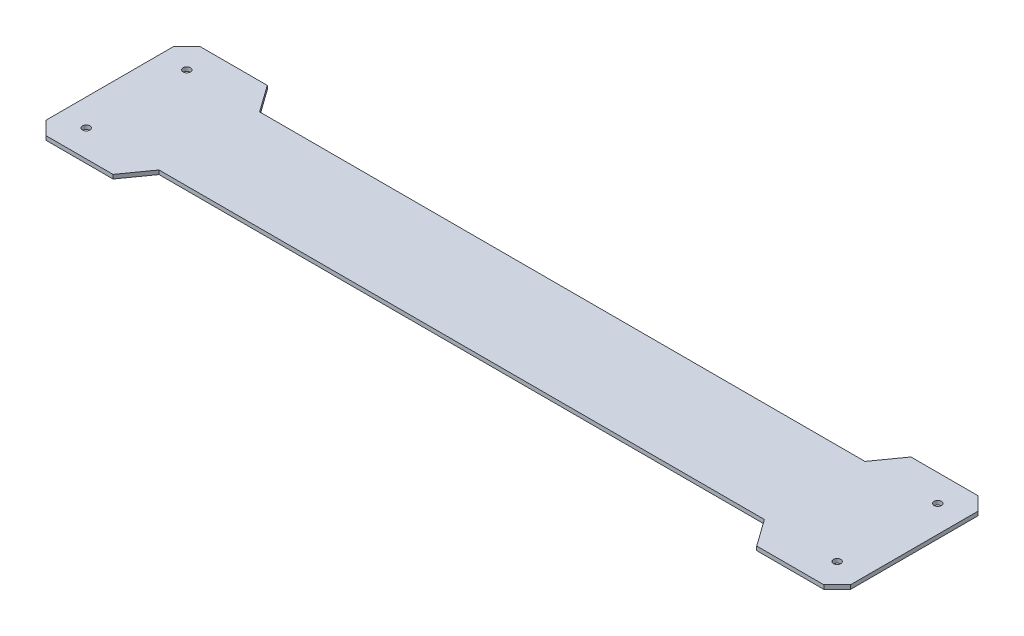
from build123d import *

# Parameters (mm, degrees)
SKETCH1_R           = 2.75
BOSS_EXTRUDE1_DEPTH = 3


with BuildPart() as part:
    # Sketch1 → Boss-Extrude1 (new body)
    with BuildSketch(Plane(origin=(0, 0, 0), x_dir=(1, 0, 0), z_dir=(0, 1, 0))):
        Polygon((14.619315376, 0), (64.619315376, 0), (78.894940901, -20), (530.343689851, -20), (544.619315376, 0), (594.619315376, 0), (604.619315376, -10), (604.619315376, -105), (594.619315376, -115), (544.619315376, -115), (530.343689851, -95), (78.894940901, -95), (64.619315376, -115), (14.619315376, -115), (4.619315376, -105), (4.619315376, -10), align=None)
        with Locations((24.619315376, -20)):
            Circle(SKETCH1_R, mode=Mode.SUBTRACT)
        with Locations((24.619315376, -95)):
            Circle(SKETCH1_R, mode=Mode.SUBTRACT)
        with Locations((584.619315376, -95)):
            Circle(SKETCH1_R, mode=Mode.SUBTRACT)
        with Locations((584.619315376, -20)):
            Circle(SKETCH1_R, mode=Mode.SUBTRACT)
    extrude(amount=BOSS_EXTRUDE1_DEPTH)


solid = part.part
